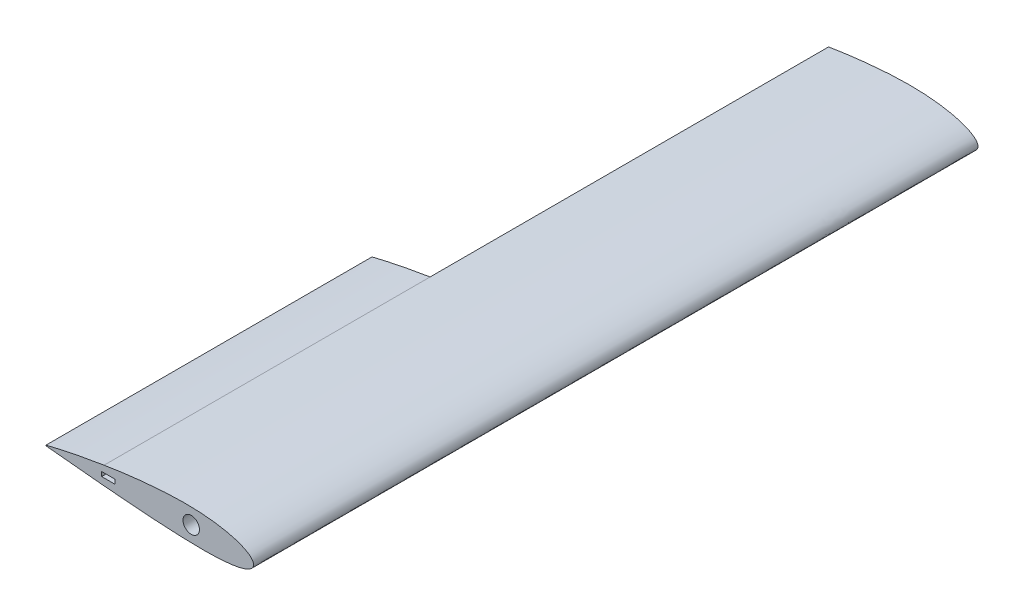
from build123d import *

# Parameters (mm, degrees)
BOSS_EXTRUDE1_DEPTH = 1120
BOSS_EXTRUDE2_DEPTH = 504
SKETCH3_R           = 12.7
CUT_EXTRUDE1_DEPTH  = 801
SKETCH4_W           = 32
SKETCH4_H           = 40.764
CUT_EXTRUDE2_DEPTH  = 46
SKETCH5_W           = 60
SKETCH5_H           = 12
CUT_EXTRUDE3_DEPTH  = 46
SKETCH6_W           = 54
SKETCH6_H           = 29.1
CUT_EXTRUDE4_DEPTH  = 64
SKETCH7_W           = 20.4
SKETCH7_H           = 6.8
CUT_EXTRUDE5_DEPTH  = 26
SKETCH8_W           = 20
SKETCH8_H           = 4
CUT_EXTRUDE6_DEPTH  = 20


with BuildPart() as part:
    # Sketch1 → Boss-Extrude1 (new body)
    with BuildSketch(Plane.XY):
        with BuildLine():
            Line((-230.9508, 18.549655218), (-230.9508, -9.254301498))
            add(Edge.make_bspline(
                [(-230.9508, 18.549655218), (-228.049495749, 19.012199792), (-221.209790862, 20.102629511), (-210.309484015, 21.694228457), (-198.177918873, 23.344790405), (-185.801278857, 24.876155415), (-173.257128714, 26.267978143), (-160.623441873, 27.493783455), (-147.979456839, 28.530532604), (-135.38680304, 29.355171085), (-122.901523706, 29.953954368), (-110.600645828, 30.233245093), (-98.584530722, 30.190184092), (-86.956752113, 29.818162025), (-75.795476598, 29.120192561), (-65.175571702, 28.104733617), (-55.167884393, 26.786610347), (-45.83844827, 25.186431442), (-37.247767676, 23.330020663), (-29.450147797, 21.247475272), (-22.49306267, 18.971935561), (-16.416484661, 16.538049824), (-11.25212628, 13.979857249), (-7.022410883, 11.327945562), (-3.740398213, 8.603289627), (-1.414154387, 5.809331387), (-0.076147693, 2.919702269), (0.174499495, -0.017526218), (-0.651971008, -2.844649473), (-2.518378552, -5.413150636), (-5.310866411, -7.706234175), (-8.995972622, -9.76681916), (-13.558597282, -11.608009751), (-18.977523447, -13.230313942), (-25.223163569, -14.62951684), (-32.259081774, -15.801834128), (-40.043593034, -16.745705279), (-48.530826795, -17.462895097), (-57.671430551, -17.959035884), (-67.413025894, -18.243888192), (-77.700502564, -18.331295899), (-88.476207861, -18.238956627), (-99.680049498, -17.987646529), (-111.249637369, -17.601440252), (-123.143365035, -17.102105049), (-135.312062781, -16.52328547), (-147.680909126, -15.81306962), (-160.152760479, -15.001217792), (-172.634499225, -14.108952492), (-185.050601402, -13.157538897), (-197.325497399, -12.166288956), (-209.383936099, -11.151676018), (-220.568663804, -10.182660427), (-227.724671483, -9.542778278), (-230.9508, -9.254301498)],
                knots=[0, 0, 0, 0, 0.018424224, 0.043434346, 0.069080412, 0.095203092, 0.121640117, 0.148227444, 0.17480049, 0.201195447, 0.227363977, 0.253181792, 0.278347264, 0.302710399, 0.326128333, 0.348466602, 0.369600377, 0.389415723, 0.407811011, 0.424698681, 0.44000774, 0.453687637, 0.465714725, 0.476103672, 0.484928355, 0.492360154, 0.498730164, 0.504586951, 0.510443348, 0.516803825, 0.524198712, 0.532940661, 0.543185695, 0.554995644, 0.568376342, 0.583298542, 0.599709376, 0.617538825, 0.636703502, 0.65710892, 0.678650912, 0.701216586, 0.724685048, 0.748928058, 0.7738107, 0.799337901, 0.825325561, 0.851504471, 0.877716004, 0.903800001, 0.929595993, 0.954944401, 0.979687675, 1, 1, 1, 1], degree=3))
        make_face()
    extrude(amount=-BOSS_EXTRUDE1_DEPTH)

    # Sketch2 → Boss-Extrude2 (add)
    with BuildSketch(Plane.XY):
        with BuildLine():
            Line((-230.9508, 18.549655218), (-230.9508, -9.254301498))
            add(Edge.make_bspline(
                [(-230.9508, -9.254301498), (-231.533938961, -9.202472505), (-235.781981249, -8.824909402), (-243.525519749, -8.116106578), (-253.99195523, -7.147735043), (-263.888990978, -6.21441807), (-273.154181285, -5.326926332), (-281.728489584, -4.492561844), (-289.557033271, -3.718989784), (-296.589424989, -3.013864374), (-302.780100501, -2.383682661), (-308.088897629, -1.837830718), (-312.480728812, -1.376034223), (-315.927726107, -1.022678484), (-318.404741576, -0.737439563), (-319.900347138, -0.617044832), (-320.574918687, -0.50340935), (-320.753795962, -0.504046046), (-320.765, -0.504085926)],
                knots=[0, 0, 0, 0, 0.019462551, 0.14178051, 0.258505433, 0.368899529, 0.472261554, 0.567931303, 0.655293986, 0.733784513, 0.802891701, 0.862162346, 0.911205133, 0.949694244, 0.977372582, 0.994054454, 0.999627599, 1, 1, 1, 1], degree=3))
            Line((-320.765, -0.504085926), (-320.765, 0.512293238))
            add(Edge.make_bspline(
                [(-230.9508, 18.549655218), (-231.863681823, 18.40666283), (-236.443645159, 17.6892645), (-244.502692973, 16.318954112), (-254.935539903, 14.478856331), (-264.776208941, 12.646572101), (-273.967279049, 10.858775003), (-282.453535586, 9.139217922), (-290.184780464, 7.514403405), (-297.115470217, 6.0093973), (-303.205072904, 4.648335665), (-308.418205118, 3.453718496), (-312.724764914, 2.445888562), (-316.100039765, 1.642515188), (-318.524733585, 1.057899145), (-319.973889731, 0.705575825), (-320.613290589, 0.549358599), (-320.765, 0.512293238)],
                knots=[0, 0, 0, 0, 0.030251696, 0.151773928, 0.267626296, 0.377089872, 0.479484952, 0.574174897, 0.660569789, 0.738129949, 0.806369318, 0.864858701, 0.913228834, 0.951173208, 0.978450569, 0.994887008, 1, 1, 1, 1], degree=3))
        make_face()
    extrude(amount=-BOSS_EXTRUDE2_DEPTH)

    # Sketch3 → Cut-Extrude1 (cut)
    with BuildSketch(Plane.XY):
        with Locations((-96.23, 6.014)):
            Circle(SKETCH3_R)
    extrude(amount=-CUT_EXTRUDE1_DEPTH, mode=Mode.SUBTRACT)

    # Sketch4 → Cut-Extrude2 (cut)
    with BuildSketch(Plane.XY.offset(-376.7)):
        with Locations((-96.23, 1.332)):
            Rectangle(SKETCH4_W, SKETCH4_H)
    extrude(amount=CUT_EXTRUDE2_DEPTH, mode=Mode.SUBTRACT)

    # Sketch5 → Cut-Extrude3 (cut)
    with BuildSketch(Plane.XY.offset(-376.7)):
        with Locations((-256.612, -2.954)):
            Rectangle(SKETCH5_W, SKETCH5_H)
    extrude(amount=CUT_EXTRUDE3_DEPTH, mode=Mode.SUBTRACT)

    # Sketch6 → Cut-Extrude4 (cut)
    with BuildSketch(Plane.XY.offset(-598.5)):
        with Locations((-176.421, -2.293)):
            Rectangle(SKETCH6_W, SKETCH6_H)
    extrude(amount=CUT_EXTRUDE4_DEPTH, mode=Mode.SUBTRACT)

    # Sketch7 → Cut-Extrude5 (cut)
    with BuildSketch(Plane.XY.offset(-25.5)):
        with Locations((-224.536, 4.811)):
            Rectangle(SKETCH7_W, SKETCH7_H)
    extrude(amount=CUT_EXTRUDE5_DEPTH, mode=Mode.SUBTRACT)

    # Sketch8 → Cut-Extrude6 (cut)
    with BuildSketch(Plane.XY.offset(-930)):
        with Locations((-50, -17.254)):
            Rectangle(SKETCH8_W, SKETCH8_H)
    extrude(amount=CUT_EXTRUDE6_DEPTH, mode=Mode.SUBTRACT)


solid = part.part
